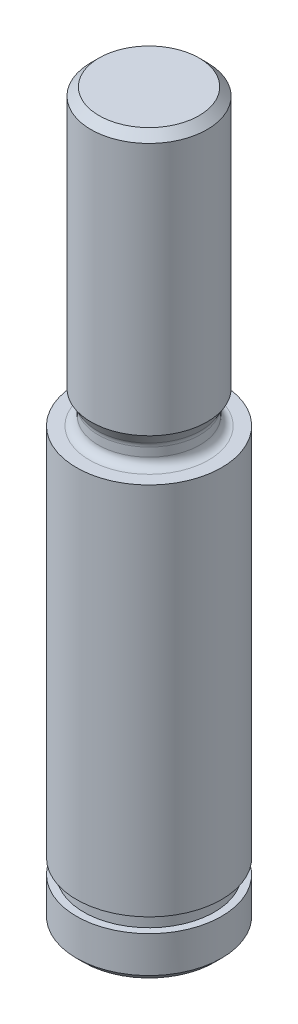
from build123d import *

# Parameters (mm, degrees)
SKETCH1_R           = 5
BOSS_EXTRUDE1_DEPTH = 50
CHAMFER1_SIZE       = 0.5
CUT_EXTRUDE2_START  = -3
SKETCH7_R           = 5
SKETCH7_R_2         = 4.5
CUT_EXTRUDE2_DEPTH  = 1


# Read off the part's stored shape, not the designer's step: M8x1.0 Machine Threads Stud1
with BuildPart() as part:
    # Sketch1 → Boss-Extrude1 (new body)
    with BuildSketch(Plane(origin=(0, 0, 0), x_dir=(1, 0, 0), z_dir=(0, 1, 0))):
        with Locations(Location((0, 0, 0), (0, 0, 270))):
            Circle(SKETCH1_R)
    extrude(amount=BOSS_EXTRUDE1_DEPTH)

    # M8x1.0 Machine Threads Stud1 outline → M8x1.0 Machine Threads Stud1 (revolve, cut)
    with BuildSketch(Plane.XY):
        with BuildLine():
            Line((5, 50), (3.4455, 50))
            Line((3.4455, 50), (4, 49.4455))
            Line((4, 49.4455), (4, 32))
            Line((4, 32), (3.580384758, 31.273205081))
            ThreePointArc((3.580384758, 31.273205081), (3.520444504, 31.128496508), (3.5, 30.973205081))
            Line((3.5, 30.973205081), (3.5, 30.373205081))
            ThreePointArc((3.5, 30.373205081), (3.675735931, 29.948941012), (4.1, 29.773205081))
            Line((4.1, 29.773205081), (5, 29.773205081))
            Line((5, 29.773205081), (5, 50))
        make_face()
    revolve(axis=Axis((0, 0, 0), (0, 1, 0)), mode=Mode.SUBTRACT)

    # Chamfer1
    chamfer1_edges = [part.edges().sort_by_distance(p)[0] for p in [
        (0, 0, -5),
    ]]
    chamfer(chamfer1_edges, length=CHAMFER1_SIZE)

    # Sketch7 → Cut-Extrude2 (cut)
    with BuildSketch(Plane.XZ.offset(CUT_EXTRUDE2_START)):
        with Locations(Location((0, 0, 0), (0, 0, 270))):
            Circle(SKETCH7_R)
        with Locations(Location((0, 0, 0), (0, 0, 270))):
            Circle(SKETCH7_R_2, mode=Mode.SUBTRACT)
    extrude(amount=-CUT_EXTRUDE2_DEPTH, mode=Mode.SUBTRACT)


solid = part.part
